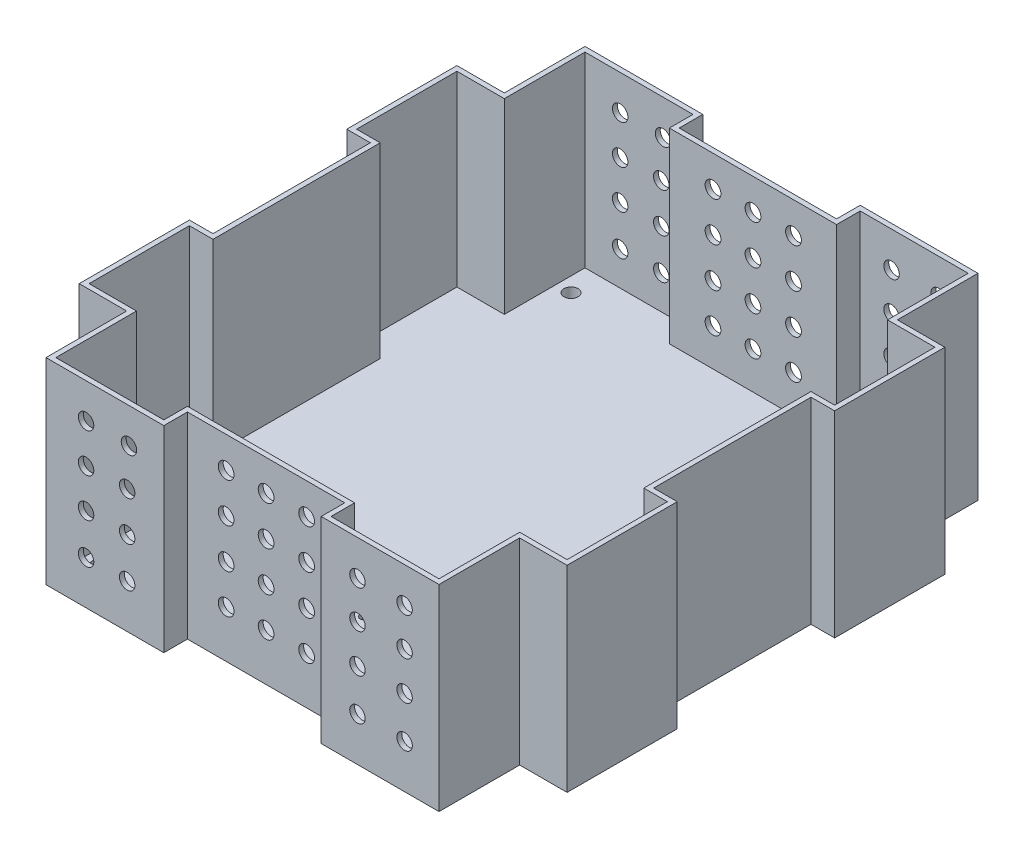
from build123d import *

# Parameters (mm, degrees)
SKETCH1_R                = 2.286
MAIN_BODY_DEPTH          = 1.5875
WALLS_DEPTH              = 63.5
SHELL2_START             = 3.175
SHELL2_DEPTH             = 60.325
CUT_EXTRUDE4_DEPTH       = 134.418018367
CUT_EXTRUDE4_DEPTH_BACK  = 134.418018367
SKETCH1_8_R              = 2.286
CROSS_BRACE_DEPTH        = 1.5875
HOLES_MIDDLE_DEPTH       = 194.353329183
HOLES_MIDDLE_DEPTH_BACK  = 194.353329183
SKETCH8_R                = 2.545226629
HOLES_SIDE_DEPTH         = 202.257938229
HOLES_SIDE_DEPTH_BACK    = 202.257938229
SKETCH9_R                = 2.499157901
FILLET2_RADIUS           = 4.064
FILLET2_LENGTH           = 1.5875
FILLET3_R                = 4.064
CUT_EXTRUDE8_DEPTH       = 134.418018367
CUT_EXTRUDE8_DEPTH_BACK  = 134.418018367
SKETCH1_12_R             = 2.286
FILLET4_RADIUS           = 4.064
FILLET4_LENGTH           = 1.5875
FILLET5_RADIUS           = 4.064
FILLET5_LENGTH           = 1.5875
SKETCH11_R               = 1.25
CAMERA_MOUNT_HOLES_DEPTH = 132.9364364


# Read off the part's stored shape, not the designer's step: Shell2
with BuildPart() as part:
    # Sketch1 → Main Body (new body)
    with BuildSketch(Plane(origin=(0, 0, 0), x_dir=(1, 0, 0), z_dir=(0, 1, 0))):
        Polygon((-25.4, 86.995), (-63.43142, 86.995), (-63.43142, 60.96), (-78.74, 60.96), (-78.74, 25.4), (-71.12, 25.4), (-71.12, -25.4), (-78.74, -25.4), (-78.74, -60.96), (-63.43142, -60.96), (-63.43142, -86.995), (-25.4, -86.995), (-25.4, -79.375), (25.4, -79.375), (25.4, -86.995), (63.43142, -86.995), (63.43142, -60.96), (78.74, -60.96), (78.74, -25.4), (71.12, -25.4), (71.12, 25.4), (78.74, 25.4), (78.74, 60.96), (63.43142, 60.96), (63.43142, 86.995), (25.4, 86.995), (25.4, 79.375), (-25.4, 79.375), align=None)
        with Locations(Location((-57.15, 76.2, 0), (0, 0, 270))):
            Circle(SKETCH1_R, mode=Mode.SUBTRACT)
        with Locations(Location((57.15, 76.2, 0), (0, 0, 270))):
            Circle(SKETCH1_R, mode=Mode.SUBTRACT)
        with Locations(Location((57.15, -76.2, 0), (0, 0, 270))):
            Circle(SKETCH1_R, mode=Mode.SUBTRACT)
        with Locations(Location((-57.15, -76.2, 0), (0, 0, 270))):
            Circle(SKETCH1_R, mode=Mode.SUBTRACT)
    extrude(amount=MAIN_BODY_DEPTH)

    # Sketch1<7> → walls (add)
    with BuildSketch(Plane(origin=(0, 0, 0), x_dir=(1, 0, 0), z_dir=(0, 1, 0))):
        Polygon((-25.4, 86.995), (-63.43142, 86.995), (-63.43142, 60.96), (-78.74, 60.96), (-78.74, 25.4), (-71.12, 25.4), (-71.12, -25.4), (-78.74, -25.4), (-78.74, -60.96), (-63.43142, -60.96), (-63.43142, -86.995), (-25.4, -86.995), (-25.4, -79.375), (25.4, -79.375), (25.4, -86.995), (63.43142, -86.995), (63.43142, -60.96), (78.74, -60.96), (78.74, -25.4), (71.12, -25.4), (71.12, 25.4), (78.74, 25.4), (78.74, 60.96), (63.43142, 60.96), (63.43142, 86.995), (25.4, 86.995), (25.4, 79.375), (-25.4, 79.375), align=None)
    extrude(amount=WALLS_DEPTH)

    # Shell2 outline → Shell2 (cut)
    with BuildSketch(Plane(origin=(0, 0, 0), x_dir=(1, 0, 0), z_dir=(0, 1, 0)).offset(SHELL2_START)):
        Polygon((-77.1525, -26.9875), (-77.1525, -59.3725), (-61.84392, -59.3725), (-61.84392, -85.4075), (-26.9875, -85.4075), (-26.9875, -77.7875), (26.9875, -77.7875), (26.9875, -85.4075), (61.84392, -85.4075), (61.84392, -59.3725), (77.1525, -59.3725), (77.1525, -26.9875), (69.5325, -26.9875), (69.5325, 26.9875), (77.1525, 26.9875), (77.1525, 59.3725), (61.84392, 59.3725), (61.84392, 85.4075), (26.9875, 85.4075), (26.9875, 77.7875), (-26.9875, 77.7875), (-26.9875, 85.4075), (-61.84392, 85.4075), (-61.84392, 59.3725), (-77.1525, 59.3725), (-77.1525, 26.9875), (-69.5325, 26.9875), (-69.5325, -26.9875), align=None)
    extrude(amount=SHELL2_DEPTH, mode=Mode.SUBTRACT)

    # Sketch1<8> → Cut-Extrude4 (cut, two sides: drawn at the far end of the back side and taken through both)
    with BuildSketch(Plane(origin=(0, 0, 0), x_dir=(1, 0, 0), z_dir=(0, 1, 0)).offset(-CUT_EXTRUDE4_DEPTH_BACK)):
        with Locations(Location((-57.15, 76.2, 0), (0, 0, 270))):
            Circle(SKETCH1_8_R)
        with Locations(Location((57.15, 76.2, 0), (0, 0, 270))):
            Circle(SKETCH1_8_R)
        with Locations(Location((57.15, -76.2, 0), (0, 0, 270))):
            Circle(SKETCH1_8_R)
        with Locations(Location((-57.15, -76.2, 0), (0, 0, 270))):
            Circle(SKETCH1_8_R)
    extrude(amount=CUT_EXTRUDE4_DEPTH + CUT_EXTRUDE4_DEPTH_BACK, mode=Mode.SUBTRACT)

    # Sketch10 → cross brace (add)
    with BuildSketch(Plane.XZ):
        Polygon((-56.184799984, -81.686399979), (0, -6.773333333), (56.124409067, -81.605878755), (62.749026436, -76.892035248), (5.08, 0), (62.687200182, 76.809600242), (56.184799818, 81.686399758), (0, 6.773333333), (-56.184799962, 81.686399949), (-62.687200038, 76.809600051), (-5.08, 0), (-62.687200016, -76.809600021), align=None)
    extrude(amount=CROSS_BRACE_DEPTH)

    # Sketch8 → holes-middle (cut, two sides: drawn at the far end of the back side and taken through both)
    with BuildSketch(Plane(origin=(0, 0, 77.7875), x_dir=(-1, 0, 0), z_dir=(0, 0, -1)).offset(-HOLES_MIDDLE_DEPTH_BACK)):
        with Locations(Location((0, 27.857460193, 0), (0, 0, 180))):
            Circle(SKETCH8_R)
        with Locations(Location((0, 15.219093486, 0), (0, 0, 180))):
            Circle(SKETCH8_R)
        with Locations(Location((0, 40.671359771, 0), (0, 0, 180))):
            Circle(SKETCH8_R)
        with Locations(Location((-13.077198884, 27.857460193, 0), (0, 0, 180))):
            Circle(SKETCH8_R)
        with Locations(Location((-13.077198884, 15.219093486, 0), (0, 0, 180))):
            Circle(SKETCH8_R)
        with Locations(Location((12.901666013, 15.219093486, 0), (0, 0, 180))):
            Circle(SKETCH8_R)
        with Locations(Location((12.901666013, 40.671359771, 0), (0, 0, 180))):
            Circle(SKETCH8_R)
        with Locations(Location((12.901666013, 27.857460193, 0), (0, 0, 180))):
            Circle(SKETCH8_R)
        with Locations(Location((-13.077198884, 40.671359771, 0), (0, 0, 180))):
            Circle(SKETCH8_R)
        with Locations(Location((-13.077198884, 53.416438943, 0), (0, 0, 180))):
            Circle(SKETCH8_R)
        with Locations(Location((0, 53.416438943, 0), (0, 0, 180))):
            Circle(SKETCH8_R)
        with Locations(Location((12.901666013, 53.416438943, 0), (0, 0, 180))):
            Circle(SKETCH8_R)
    extrude(amount=HOLES_MIDDLE_DEPTH + HOLES_MIDDLE_DEPTH_BACK, mode=Mode.SUBTRACT)

    # Sketch9 → holes-side (cut, two sides: drawn at the far end of the back side and taken through both)
    with BuildSketch(Plane.XY.offset(86.995).offset(-HOLES_SIDE_DEPTH_BACK)):
        with Locations((-50.495622987, 27.1034668)):
            Circle(SKETCH9_R)
        with Locations((-50.495622987, 39.636115396)):
            Circle(SKETCH9_R)
        with Locations((-50.495622987, 14.084113403)):
            Circle(SKETCH9_R)
        with Locations((-37.232917191, 39.879467796)):
            Circle(SKETCH9_R)
        with Locations((-37.232917191, 27.1034668)):
            Circle(SKETCH9_R)
        with Locations((-37.232917191, 14.084113403)):
            Circle(SKETCH9_R)
        with Locations((37.111240991, 39.879467796)):
            Circle(SKETCH9_R)
        with Locations((37.111240991, 27.468495399)):
            Circle(SKETCH9_R)
        with Locations((37.111240991, 14.084113403)):
            Circle(SKETCH9_R)
        with Locations((52.320765987, 39.879467796)):
            Circle(SKETCH9_R)
        with Locations((52.320765987, 27.468495399)):
            Circle(SKETCH9_R)
        with Locations((52.320765987, 14.084113403)):
            Circle(SKETCH9_R)
        with Locations((52.320765987, 52.07151745)):
            Circle(SKETCH9_R)
        with Locations((37.111240991, 52.07151745)):
            Circle(SKETCH9_R)
        with Locations((-50.495622987, 52.206009599)):
            Circle(SKETCH9_R)
        with Locations((-36.649110701, 52.206009599)):
            Circle(SKETCH9_R)
    extrude(amount=HOLES_SIDE_DEPTH + HOLES_SIDE_DEPTH_BACK, mode=Mode.SUBTRACT)

    # Fillet2: full round fillet: the end face becomes a half cylinder, R = half its width
    fillet2_face = Plane((-59.436, -0.79375, 79.248), x_dir=(0, 1, 0), z_dir=(-0.59999998746, 0, 0.800000009405))  # on the end face: x along it, z out of the body
    fillet2_slab = fillet2_face.offset(-FILLET2_RADIUS / 2) * Box(FILLET2_LENGTH, 2 * FILLET2_RADIUS, FILLET2_RADIUS, mode=Mode.PRIVATE)  # the body's end, R deep
    fillet2_round = Plane((-56.997600051, -0.79375, 75.996799962), x_dir=(-0.59999998746, 0, 0.800000009405), z_dir=(0, 1, 0)) * Cylinder(FILLET2_RADIUS, FILLET2_LENGTH, mode=Mode.PRIVATE)  # its axis R under the face
    add(fillet2_slab - fillet2_round, mode=Mode.SUBTRACT)

    # Fillet3
    fillet3_edges = [part.edges().sort_by_distance(p)[0] for p in [
        (56.124409067, -0.79375, -81.605878755),
        (62.749026436, -0.79375, -76.892035248),
    ]]
    fillet(fillet3_edges, radius=FILLET3_R - 0.0001)  # a hair under: the kernel refuses the full size

    # Sketch1<12> → Cut-Extrude8 (cut, two sides: drawn at the far end of the back side and taken through both)
    with BuildSketch(Plane(origin=(0, 0, 0), x_dir=(1, 0, 0), z_dir=(0, 1, 0)).offset(-CUT_EXTRUDE8_DEPTH_BACK)):
        with Locations(Location((-57.15, 76.2, 0), (0, 0, 270))):
            Circle(SKETCH1_12_R)
        with Locations(Location((57.15, 76.2, 0), (0, 0, 270))):
            Circle(SKETCH1_12_R)
        with Locations(Location((57.15, -76.2, 0), (0, 0, 270))):
            Circle(SKETCH1_12_R)
        with Locations(Location((-57.15, -76.2, 0), (0, 0, 270))):
            Circle(SKETCH1_12_R)
    extrude(amount=CUT_EXTRUDE8_DEPTH + CUT_EXTRUDE8_DEPTH_BACK, mode=Mode.SUBTRACT)

    # Fillet4: full round fillet: the end face becomes a half cylinder, R = half its width
    fillet4_face = Plane((-59.436, -0.79375, -79.248), x_dir=(0, 1, 0), z_dir=(-0.599999994776, 0, -0.800000003918))  # on the end face: x along it, z out of the body
    fillet4_slab = fillet4_face.offset(-FILLET4_RADIUS / 2) * Box(FILLET4_LENGTH, 2 * FILLET4_RADIUS, FILLET4_RADIUS, mode=Mode.PRIVATE)  # the body's end, R deep
    fillet4_round = Plane((-56.997600021, -0.79375, -75.996799984), x_dir=(-0.599999994776, 0, -0.800000003918), z_dir=(0, 1, 0)) * Cylinder(FILLET4_RADIUS, FILLET4_LENGTH, mode=Mode.PRIVATE)  # its axis R under the face
    add(fillet4_slab - fillet4_round, mode=Mode.SUBTRACT)

    # Fillet5: full round fillet: the end face becomes a half cylinder, R = half its width
    fillet5_face = Plane((59.436, -0.79375, 79.248), x_dir=(0, 1, 0), z_dir=(0.599999940349, 0, 0.800000044738))  # on the end face: x along it, z out of the body
    fillet5_slab = fillet5_face.offset(-FILLET5_RADIUS / 2) * Box(FILLET5_LENGTH, 2 * FILLET5_RADIUS, FILLET5_RADIUS, mode=Mode.PRIVATE)  # the body's end, R deep
    fillet5_round = Plane((56.997600242, -0.79375, 75.996799818), x_dir=(0.599999940349, 0, 0.800000044738), z_dir=(0, 1, 0)) * Cylinder(FILLET5_RADIUS, FILLET5_LENGTH, mode=Mode.PRIVATE)  # its axis R under the face
    add(fillet5_slab - fillet5_round, mode=Mode.SUBTRACT)

    # Sketch11 → camera mount holes (cut, through all)
    with BuildSketch(Plane(origin=(0, 3.175, 0), x_dir=(1, 0, 0), z_dir=(0, 1, 0))):
        with Locations(Location((0, -69.6775, 0), (0, 0, 270))):
            Circle(SKETCH11_R)
        with Locations(Location((0, -58.7375, 0), (0, 0, 270))):
            Circle(SKETCH11_R)
        with Locations(Location((0, -47.7975, 0), (0, 0, 270))):
            Circle(SKETCH11_R)
    extrude(amount=-CAMERA_MOUNT_HOLES_DEPTH, mode=Mode.SUBTRACT)


solid = part.part
